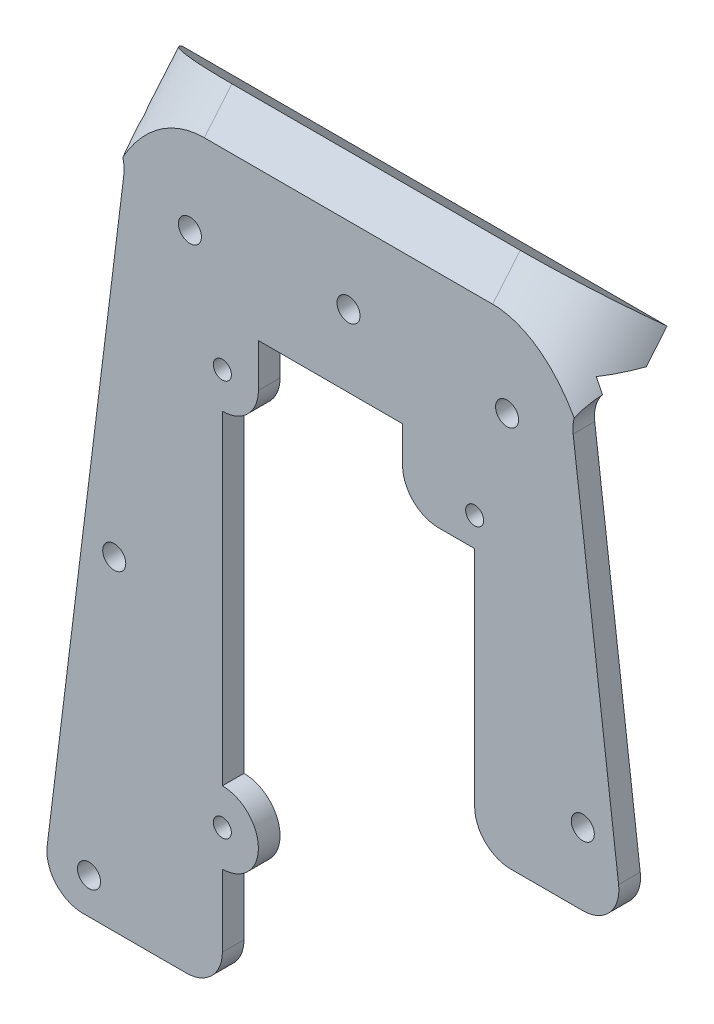
from build123d import *

# Parameters (mm, degrees)
SKETCH_1_R                  = 1.6
EXTRUDE_1_DEPTH             = 3
CUT_EXTRUDE_1_REACH         = 72.365
SKETCH_2_W                  = 30
SKETCH_2_H                  = 35
CUT_EXTRUDE_2_REACH         = 72.365
SKETCH_3_W                  = 35
SKETCH_3_H                  = 55
CUT_EXTRUDE_3_REACH         = 72.365
SKETCH_4_W                  = 25
SKETCH_4_H                  = 10
EXTRUDE_2_REACH             = 72.365
EXTRUDE_2_DIRECTION_2_REACH = 72.365
EXTRUDE_3_DEPTH             = 35
EXTRUDE_3_DEPTH_BACK        = 35
FILLET_1_R                  = 5
CUT_EXTRUDE_5_REACH         = 99.66
SKETCH_8_W                  = 70
SKETCH_8_H                  = 5
CUT_EXTRUDE_4_REACH         = 99.66
CUT_EXTRUDE_6_REACH         = 101.977
SKETCH_9_W                  = 30
SKETCH_9_H                  = 3
FILLET_2_R                  = 5
CUT_EXTRUDE_7_REACH         = 76.866
SKETCH_10_R                 = 1.25
SKETCH_11_R                 = 5
SKETCH_11_R_2               = 1.25
EXTRUDE_4_DEPTH             = 3


with BuildPart() as part:
    # 草图1 → 凸台-拉伸1 (new body)
    with BuildSketch(Plane.XY):
        Polygon((-30, 56), (30, 56), (42.5, -45), (-42.5, -45), align=None)
        with Locations((-32.5, 0)):
            Circle(SKETCH_1_R, mode=Mode.SUBTRACT)
        with Locations((32.5, 0)):
            Circle(SKETCH_1_R, mode=Mode.SUBTRACT)
        with Locations((-22, 44.5)):
            Circle(SKETCH_1_R, mode=Mode.SUBTRACT)
        with Locations(Location((22, 44.5, 0), (0, 0, 180))):
            Circle(SKETCH_1_R, mode=Mode.SUBTRACT)
        with Locations((0, 46)):
            Circle(SKETCH_1_R, mode=Mode.SUBTRACT)
        with Locations((-36, -40)):
            Circle(SKETCH_1_R, mode=Mode.SUBTRACT)
    extrude(amount=EXTRUDE_1_DEPTH)

    # 草图2 → 切除-拉伸1 (cut, up to next)
    with BuildSketch(Plane.XY.offset(3), mode=Mode.PRIVATE) as cut_extrude_1_sk1:
        with Locations((27.5, -27.5)):
            Rectangle(SKETCH_2_W, SKETCH_2_H)
    cut_extrude_1_tool1 = extrude(cut_extrude_1_sk1.sketch, amount=-CUT_EXTRUDE_1_REACH, mode=Mode.PRIVATE) & part.part
    add(cut_extrude_1_tool1.solids().sort_by_distance((27.5, -27.5, 3))[0], mode=Mode.SUBTRACT)

    # 草图3 → 切除-拉伸2 (cut, up to next)
    with BuildSketch(Plane.XY.offset(3), mode=Mode.PRIVATE) as cut_extrude_2_sk1:
        with Locations((0, -1.5)):
            Rectangle(SKETCH_3_W, SKETCH_3_H)
    cut_extrude_2_tool1 = extrude(cut_extrude_2_sk1.sketch, amount=-CUT_EXTRUDE_2_REACH, mode=Mode.PRIVATE) & part.part
    add(cut_extrude_2_tool1.solids().sort_by_distance((0, -1.5, 3))[0], mode=Mode.SUBTRACT)

    # 草图4 → 切除-拉伸3 (cut, up to next)
    with BuildSketch(Plane.XY.offset(3), mode=Mode.PRIVATE) as cut_extrude_3_sk1:
        with Locations((-5, 31)):
            Rectangle(SKETCH_4_W, SKETCH_4_H)
    cut_extrude_3_tool1 = extrude(cut_extrude_3_sk1.sketch, amount=-CUT_EXTRUDE_3_REACH, mode=Mode.PRIVATE) & part.part
    add(cut_extrude_3_tool1.solids().sort_by_distance((-5, 31, 3))[0], mode=Mode.SUBTRACT)

    # 凸台-拉伸2: up to this plane
    extrude_2_end = Plane(origin=(30, 56, 3), z_dir=(-0.9924283093332451, -0.12282528580856998, 0))
    # 草图5 → 凸台-拉伸2 (add, up to the surface)
    with BuildSketch(Plane(origin=(0, 0, 0), x_dir=(0, 0, -1), z_dir=(1, 0, 0)), mode=Mode.PRIVATE) as extrude_2_sk1:
        Polygon((0, 56), (-3, 58.517298894), (-3, 56), align=None)
    extrude_2_tool1 = split(extrude(extrude_2_sk1.sketch, amount=EXTRUDE_2_REACH, mode=Mode.PRIVATE), bisect_by=extrude_2_end, keep=Keep.BOTH, mode=Mode.PRIVATE)
    add(extrude_2_tool1.solids().sort_by_distance((0, 56.8391, 2))[0])

    # 凸台-拉伸2 direction 2: up to this plane
    extrude_2_direction_2_end = Plane(origin=(-30, 56, 3), z_dir=(0.9924283093332451, -0.12282528580856998, 0))
    # 草图5 → 凸台-拉伸2 direction 2 (add, up to the surface)
    with BuildSketch(Plane(origin=(0, 0, 0), x_dir=(0, 0, -1), z_dir=(1, 0, 0)), mode=Mode.PRIVATE) as extrude_2_direction_2_sk1:
        Polygon((0, 56), (-3, 58.517298894), (-3, 56), align=None)
    extrude_2_direction_2_tool1 = split(extrude(extrude_2_direction_2_sk1.sketch, amount=-EXTRUDE_2_DIRECTION_2_REACH, mode=Mode.PRIVATE), bisect_by=extrude_2_direction_2_end, keep=Keep.BOTH, mode=Mode.PRIVATE)
    add(extrude_2_direction_2_tool1.solids().sort_by_distance((0, 56.8391, 2))[0])

    # 草图6 → 凸台-拉伸3 (add, two sides: drawn at the far end of the back side and taken through both)
    with BuildSketch(Plane(origin=(0, 0, 0), x_dir=(0, 0, -1), z_dir=(1, 0, 0)).offset(-EXTRUDE_3_DEPTH_BACK)):
        Polygon((-3, 58.517298894), (-3, 64.391631696), (7.552988675, 55.536622791), (4.660444431, 52.089422797), (-3, 52.089422797), align=None)
    extrude(amount=EXTRUDE_3_DEPTH + EXTRUDE_3_DEPTH_BACK)

    # 圆角1
    # the kernel refuses this fillet: 5 mm, written as the material it adds along each edge
    with BuildSketch(Plane(origin=(-30.483982327, 52.089422797, 3), x_dir=(-1, 0, 0), z_dir=(0, 0, -1)), Plane(origin=(30.483982327, 52.089422797, 0), x_dir=(1, 0, 0), z_dir=(0, 0, 1))) as fillet_1_piece_1:
        with BuildLine():
            CenterArc((5.641090005, -4.871777114), FILLET_1_R, 103.003728842, 84.05145722)
            Line((0.678948458, -5.485903543), (0.579705627, -5.498186072))
            Line((0.579705627, -5.498186072), (-0.099242831, -0.012282529))
            Line((-0.099242831, -0.012282529), (0, 0.1))
            ThreePointArc((0, 0.1), (2.258008836, 0.1), (4.493516226, 0.097435542))
            Line((4.493516226, 0.097435542), (4.516017673, 0))
        make_face()
    extrude(amount=3)

    # 草图8 → 切除-拉伸5 (cut, up to next)
    with BuildSketch(Plane(origin=(0, 36.309348969, -30.467161328), x_dir=(1, 0, 0), z_dir=(0, 0.7660444431189815, -0.6427876096865354)), mode=Mode.PRIVATE) as cut_extrude_5_sk1:
        with Locations((0, -41.188276351)):
            Rectangle(SKETCH_8_W, SKETCH_8_H)
    cut_extrude_5_tool1 = extrude(cut_extrude_5_sk1.sketch, amount=-CUT_EXTRUDE_5_REACH, mode=Mode.PRIVATE) & part.part
    add(cut_extrude_5_tool1.solids().sort_by_distance((0, 62.784663, 1.084889))[0], mode=Mode.SUBTRACT)

    # 草图7 → 切除-拉伸4 (cut, up to next)
    with BuildSketch(Plane(origin=(0, 36.309348969, -30.467161328), x_dir=(1, 0, 0), z_dir=(0, 0.7660444431189815, -0.6427876096865354)), mode=Mode.PRIVATE) as cut_extrude_4_sk1:
        with BuildLine():
            Line((-35, -23.688276351), (-35, -38.688276351))
            Line((-35, -38.688276351), (-20, -38.688276351))
            ThreePointArc((-20, -38.688276351), (-30.606601718, -34.294878069), (-35, -23.688276351))
        make_face()
    cut_extrude_4_tool1 = extrude(cut_extrude_4_sk1.sketch, amount=-CUT_EXTRUDE_4_REACH, mode=Mode.PRIVATE) & part.part
    # 草图7 → 切除-拉伸4 (cut, up to next)
    with BuildSketch(Plane(origin=(0, 36.309348969, -30.467161328), x_dir=(1, 0, 0), z_dir=(0, 0.7660444431189815, -0.6427876096865354)), mode=Mode.PRIVATE) as cut_extrude_4_sk2:
        with BuildLine():
            Line((35, -38.688276351), (20, -38.688276351))
            ThreePointArc((20, -38.688276351), (30.606601718, -34.294878069), (35, -23.688276351))
            Line((35, -23.688276351), (35, -38.688276351))
        make_face()
    cut_extrude_4_tool2 = extrude(cut_extrude_4_sk2.sketch, amount=-CUT_EXTRUDE_4_REACH, mode=Mode.PRIVATE) & part.part
    add(cut_extrude_4_tool1.solids().sort_by_distance((-31.649481, 59.024021, -3.396869))[0], mode=Mode.SUBTRACT)
    add(cut_extrude_4_tool2.solids().sort_by_distance((31.649481, 59.024021, -3.396869))[0], mode=Mode.SUBTRACT)

    # 草图9 → 切除-拉伸6 (cut, up to next)
    with BuildSketch(Plane(origin=(0, -29, 0), x_dir=(1, 0, 0), z_dir=(0, 1, 0)), mode=Mode.PRIVATE) as cut_extrude_6_sk1:
        with Locations((-2.5, -1.5)):
            Rectangle(SKETCH_9_W, SKETCH_9_H)
    cut_extrude_6_tool1 = extrude(cut_extrude_6_sk1.sketch, amount=-CUT_EXTRUDE_6_REACH, mode=Mode.PRIVATE) & part.part
    add(cut_extrude_6_tool1.solids().sort_by_distance((-2.5, -29, 1.5))[0], mode=Mode.SUBTRACT)

    # 圆角2
    fillet_2_edges = [part.edges().sort_by_distance(p)[0] for p in [
        (-17.5, -45, 1.5),
        (38.168316832, -10, 1.5),
        (17.5, -10, 1.5),
        (7.5, 26, 1.5),
        (-42.5, -45, 1.5),
    ]]
    fillet(fillet_2_edges, radius=FILLET_2_R)

    # 草图10 → 切除-拉伸7 (cut, up to next)
    with BuildSketch(Plane.XY.offset(3), mode=Mode.PRIVATE) as cut_extrude_7_sk1:
        with Locations((17.5, 30)):
            Circle(SKETCH_10_R)
    cut_extrude_7_tool1 = extrude(cut_extrude_7_sk1.sketch, amount=-CUT_EXTRUDE_7_REACH, mode=Mode.PRIVATE) & part.part
    # 草图10 → 切除-拉伸7 (cut, up to next)
    with BuildSketch(Plane.XY.offset(3), mode=Mode.PRIVATE) as cut_extrude_7_sk2:
        with Locations((-17.5, 30)):
            Circle(SKETCH_10_R)
    cut_extrude_7_tool2 = extrude(cut_extrude_7_sk2.sketch, amount=-CUT_EXTRUDE_7_REACH, mode=Mode.PRIVATE) & part.part
    # 草图10 → 切除-拉伸7 (cut, up to next)
    with BuildSketch(Plane.XY.offset(3), mode=Mode.PRIVATE) as cut_extrude_7_sk3:
        with Locations((-17.5, -25)):
            Circle(SKETCH_10_R)
    cut_extrude_7_tool3 = extrude(cut_extrude_7_sk3.sketch, amount=-CUT_EXTRUDE_7_REACH, mode=Mode.PRIVATE) & part.part
    add(cut_extrude_7_tool1.solids().sort_by_distance((17.5, 30, 3))[0], mode=Mode.SUBTRACT)
    add(cut_extrude_7_tool2.solids().sort_by_distance((-17.5, 30, 3))[0], mode=Mode.SUBTRACT)
    add(cut_extrude_7_tool3.solids().sort_by_distance((-17.5, -25, 3))[0], mode=Mode.SUBTRACT)

    # 草图11 → 凸台-拉伸4 (add)
    # profile 1 of 2: a face of its own
    with BuildSketch(Plane.XY.offset(3)):
        with Locations((-17.5, -25)):
            Circle(SKETCH_11_R)
        with Locations((-17.5, -25)):
            Circle(SKETCH_11_R_2, mode=Mode.SUBTRACT)
    # profile 2 of 2: a face of its own
    with BuildSketch(Plane.XY.offset(3)):
        with BuildLine():
            Line((-12.5, 30), (-12.5, 36))
            Line((-12.5, 36), (-17.5, 36))
            Line((-17.5, 36), (-17.5, 35))
            ThreePointArc((-17.5, 35), (-21.035533906, 26.464466094), (-12.5, 30))
        make_face()
        with Locations((-17.5, 30)):
            Circle(SKETCH_11_R_2, mode=Mode.SUBTRACT)
    extrude(amount=-EXTRUDE_4_DEPTH)


solid = part.part
